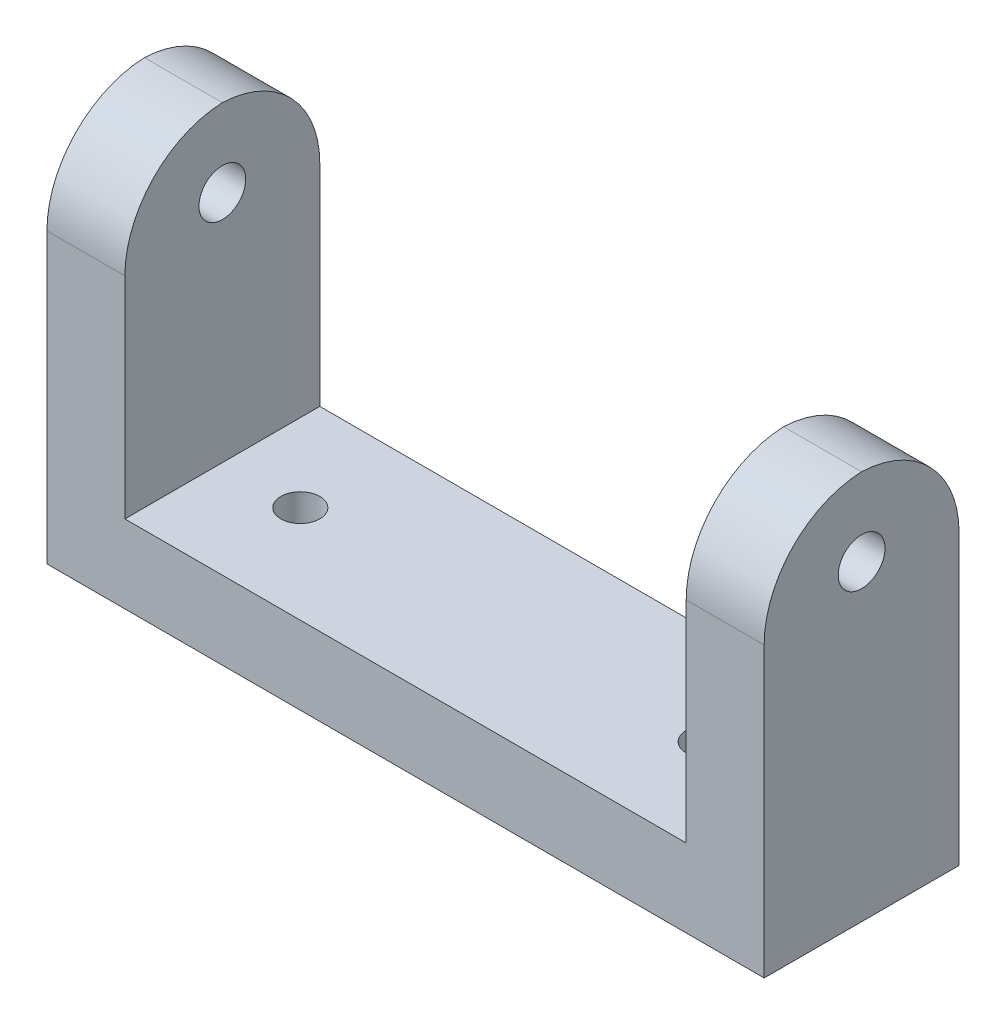
from build123d import *

# Parameters (mm, degrees)
BOSS_EXTRUDE1_DEPTH = 25
SKETCH2_R           = 3
CUT_EXTRUDE1_DEPTH  = 108.652217813
SKETCH3_R           = 2.5
CUT_EXTRUDE2_DEPTH  = 20
FILLET2_R           = 13


with BuildPart() as part:
    # Sketch1 → Boss-Extrude1 (new body)
    with BuildSketch(Plane.XY):
        Polygon((0, 50), (10, 50), (10, 10), (82, 10), (82, 50), (92, 50), (92, 0), (0, 0), align=None)
    extrude(amount=BOSS_EXTRUDE1_DEPTH)

    # Sketch2 → Cut-Extrude1 (cut, through all)
    with BuildSketch(Plane(origin=(92, 0, 0), x_dir=(0, 0, -1), z_dir=(1, 0, 0))):
        with Locations((-12.5, 40)):
            Circle(SKETCH2_R)
    extrude(amount=-CUT_EXTRUDE1_DEPTH, mode=Mode.SUBTRACT)

    # Sketch3 → Cut-Extrude2 (cut)
    with BuildSketch(Plane(origin=(0, 10, 0), x_dir=(1, 0, 0), z_dir=(0, 1, 0))):
        with Locations(Location((20, -12.5, 0), (0, 0, 270))):
            Circle(SKETCH3_R)
        with Locations(Location((72, -12.5, 0), (0, 0, 270))):
            Circle(SKETCH3_R)
    extrude(amount=-CUT_EXTRUDE2_DEPTH, mode=Mode.SUBTRACT)

    # Fillet2
    # the kernel refuses this fillet: 13 mm, written as the material it takes off along each edge
    with BuildSketch(Plane(origin=(49.5, 50, 0), x_dir=(0, -1, 0), z_dir=(1, 0, 0)), Plane(origin=(-32.5, 50, 25), x_dir=(0, 0, -1), z_dir=(1, 0, 0))) as fillet2_piece_1:
        with BuildLine():
            CenterArc((FILLET2_R, -FILLET2_R), FILLET2_R, 90, 90)
            Line((0, -FILLET2_R), (0, 0))
            Line((0, 0), (FILLET2_R, 0))
        make_face()
    extrude(amount=75, mode=Mode.SUBTRACT)
    with BuildSketch(Plane(origin=(49.5, 50, 25), x_dir=(0, -1, 0), z_dir=(1, 0, 0)), Plane(origin=(-32.5, 50, 0), x_dir=(0, 0, 1), z_dir=(1, 0, 0))) as fillet2_piece_2:
        with BuildLine():
            CenterArc((FILLET2_R, FILLET2_R), FILLET2_R, 180, 90)
            Line((0, FILLET2_R), (0, 0))
            Line((0, 0), (FILLET2_R, 0))
        make_face()
    extrude(amount=75, mode=Mode.SUBTRACT)


solid = part.part
